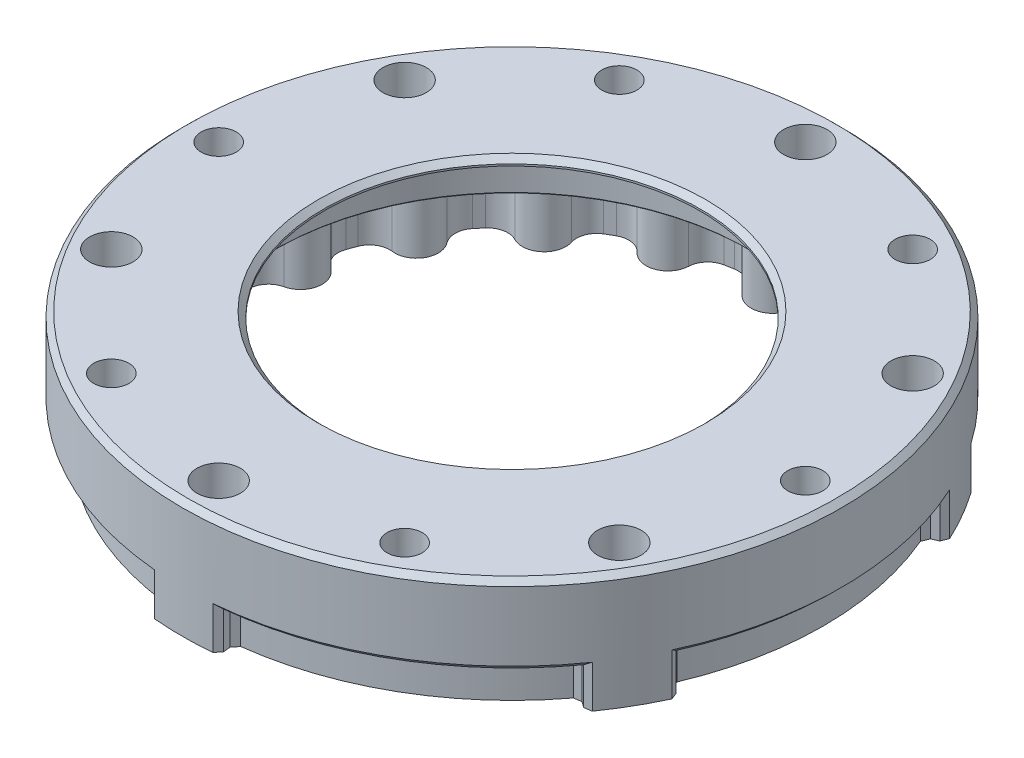
from build123d import *

# Parameters (mm, degrees)
SKETCH2_R                       = 45.5
SKETCH2_R_2                     = 37
BOSS_EXTRUDE1_DEPTH             = 7.125
BOSS_EXTRUDE2_REACH             = 66.74
BOSS_EXTRUDE2_DIRECTION_2_REACH = 66.74
FILLET1_R                       = 2.8
CIRPATTERN1_COUNT               = 18
FILLET1_OF_CIRPATTERN1_R        = 2.8
CUT_EXTRUDE1_REACH              = 67.906
SKETCH4_R                       = 1.59
BOSS_EXTRUDE3_START             = 9
SKETCH5_R                       = 45.5
SKETCH5_R_2                     = 1.59
SKETCH5_R_3                     = 32.56
BOSS_EXTRUDE3_DEPTH             = 9
SKETCH6_R                       = 32.56
SKETCH6_R_2                     = 30.56
BOSS_EXTRUDE4_DEPTH             = 1.5
SKETCH7_R                       = 3
SKETCH7_R_2                     = 1.59
SKETCH7_R_3                     = 2.425
CUT_EXTRUDE2_DEPTH              = 6
SKETCH9_R                       = 3
SKETCH9_R_2                     = 1.59
CUT_EXTRUDE3_DEPTH              = 0.7
SKETCH8_R                       = 30.56
SKETCH8_R_2                     = 26
BOSS_EXTRUDE5_DEPTH             = 1
CHAMFER1_SIZE                   = 0.75
CHAMFER2_SIZE                   = 0.2
CUT_EXTRUDE4_START              = -5.125
CUT_EXTRUDE4_DEPTH              = 5.125
CHAMFER3_DEPTH                  = 5.125
CHAMFER3_START                  = 5.125
CHAMFER3_2_DEPTH                = 0.731753644
CHAMFER3_START_2                = -1
CHAMFER3_3_DEPTH                = 6.125
CIRPATTERN3_COUNT               = 6


with BuildPart() as part:
    # Sketch2 → Boss-Extrude1 (new, symmetric)
    with BuildSketch(Plane(origin=(0, 0, 0), x_dir=(1, 0, 0), z_dir=(0, 1, 0))):
        with Locations(Location((0, 0, 0), (0, 0, 90))):
            Circle(SKETCH2_R)
        with Locations(Location((0, 0, 0), (0, 0, 90))):
            Circle(SKETCH2_R_2, mode=Mode.SUBTRACT)
    extrude(amount=BOSS_EXTRUDE1_DEPTH, both=True)

    # Boss-Extrude2: up to this face of the body (flat: up to its plane)
    boss_extrude2_end = Plane(part.part.faces().sort_by_distance((0, 7.125, 44.213065658))[0])
    # Sketch3 → Boss-Extrude2 (add, up to the picked face)
    with BuildSketch(Plane(origin=(0, 0, 0), x_dir=(1, 0, 0), z_dir=(0, 1, 0)), mode=Mode.PRIVATE) as boss_extrude2_sk1:
        with BuildLine():
            Line((-3, 36.01), (-3, 36.878177829))
            ThreePointArc((-3, 36.878177829), (0, 37), (3, 36.878177829))
            Line((3, 36.878177829), (3, 36.01))
            ThreePointArc((3, 36.01), (0, 33.01), (-3, 36.01))
        make_face()
    boss_extrude2_tool1 = split(extrude(boss_extrude2_sk1.sketch, amount=BOSS_EXTRUDE2_REACH, mode=Mode.PRIVATE), bisect_by=boss_extrude2_end, keep=Keep.BOTH, mode=Mode.PRIVATE)
    boss_extrude2 = boss_extrude2_tool1.solids().sort_by(Axis((0, 0, -35.238996), (0, 1, 0)))[0]
    add(boss_extrude2)

    # Boss-Extrude2 direction 2: up to this face of the body (flat: up to its plane)
    boss_extrude2_direction_2_end = Plane(part.part.faces().sort_by_distance((0, -7.125, 44.213065658))[0])
    # Sketch3 → Boss-Extrude2 direction 2 (add, up to the picked face)
    with BuildSketch(Plane(origin=(0, 0, 0), x_dir=(1, 0, 0), z_dir=(0, 1, 0)), mode=Mode.PRIVATE) as boss_extrude2_direction_2_sk1:
        with BuildLine():
            Line((-3, 36.01), (-3, 36.878177829))
            ThreePointArc((-3, 36.878177829), (0, 37), (3, 36.878177829))
            Line((3, 36.878177829), (3, 36.01))
            ThreePointArc((3, 36.01), (0, 33.01), (-3, 36.01))
        make_face()
    boss_extrude2_direction_2_tool1 = split(extrude(boss_extrude2_direction_2_sk1.sketch, amount=-BOSS_EXTRUDE2_DIRECTION_2_REACH, mode=Mode.PRIVATE), bisect_by=boss_extrude2_direction_2_end, keep=Keep.BOTH, mode=Mode.PRIVATE)
    boss_extrude2_direction_2 = boss_extrude2_direction_2_tool1.solids().sort_by(Axis((0, 0, -35.238996), (0, -1, 0)))[0]
    add(boss_extrude2_direction_2)

    # Fillet1
    fillet1_edges = [part.edges().sort_by_distance(p)[0] for p in [
        (-3, 0, -36.878177829),
        (3, 0, -36.878177829),
    ]]
    fillet(fillet1_edges, radius=FILLET1_R)

    # CirPattern1: Boss-Extrude2, Boss-Extrude2 direction 2 ×18 about axis
    cirpattern1_axis = Axis((0, 0, 0), (0, 1, 0))
    add([boss_extrude2.rotate(cirpattern1_axis, i * 360 / CIRPATTERN1_COUNT) for i in range(1, CIRPATTERN1_COUNT)])
    add([boss_extrude2_direction_2.rotate(cirpattern1_axis, i * 360 / CIRPATTERN1_COUNT) for i in range(1, CIRPATTERN1_COUNT)])

    # Fillet1 of CirPattern1
    fillet1_of_cirpattern1_edges = [part.edges().sort_by_distance(p)[0] for p in [
        (-15.432157529, 0, -33.628091144),
        (-9.794001804, 0, -35.680212004),
        (-26.002969106, 0, -26.321960369),
        (-21.406702447, 0, -30.178686027),
        (-33.437438845, 0, -15.841012703),
        (-30.437438845, 0, -21.037165126),
        (-36.838859976, 0, -3.449405117),
        (-35.79697091, 0, -9.358251635),
        (-35.79697091, 0, 9.358251635),
        (-36.838859976, 0, 3.449405117),
        (-30.437438845, 0, 21.037165126),
        (-33.437438845, 0, 15.841012703),
        (-21.406702447, 0, 30.178686027),
        (-26.002969106, 0, 26.321960369),
        (-9.794001804, 0, 35.680212004),
        (-15.432157529, 0, 33.628091144),
        (3, 0, 36.878177829),
        (-3, 0, 36.878177829),
        (15.432157529, 0, 33.628091144),
        (9.794001804, 0, 35.680212004),
        (26.002969106, 0, 26.321960369),
        (21.406702447, 0, 30.178686027),
        (33.437438845, 0, 15.841012703),
        (30.437438845, 0, 21.037165126),
        (36.838859976, 0, 3.449405117),
        (35.79697091, 0, 9.358251635),
        (35.79697091, 0, -9.358251635),
        (36.838859976, 0, -3.449405117),
        (30.437438845, 0, -21.037165126),
        (33.437438845, 0, -15.841012703),
        (21.406702447, 0, -30.178686027),
        (26.002969106, 0, -26.321960369),
        (9.794001804, 0, -35.680212004),
        (15.432157529, 0, -33.628091144),
    ]]
    fillet(fillet1_of_cirpattern1_edges, radius=FILLET1_OF_CIRPATTERN1_R)

    # Sketch4 → Cut-Extrude1 (cut, up to next)
    with BuildSketch(Plane(origin=(0, 7.125, 0), x_dir=(1, 0, 0), z_dir=(0, 1, 0)), mode=Mode.PRIVATE) as cut_extrude1_sk1:
        with Locations(Location((0, 40.5, 0), (0, 0, 270))):
            Circle(SKETCH4_R)
    cut_extrude1_tool1 = extrude(cut_extrude1_sk1.sketch, amount=-CUT_EXTRUDE1_REACH, mode=Mode.PRIVATE) & part.part
    # Sketch4 → Cut-Extrude1 (cut, up to next)
    with BuildSketch(Plane(origin=(0, 7.125, 0), x_dir=(1, 0, 0), z_dir=(0, 1, 0)), mode=Mode.PRIVATE) as cut_extrude1_sk2:
        with Locations(Location((35.074028853, 20.25, 0), (0, 0, 270))):
            Circle(SKETCH4_R)
    cut_extrude1_tool2 = extrude(cut_extrude1_sk2.sketch, amount=-CUT_EXTRUDE1_REACH, mode=Mode.PRIVATE) & part.part
    # Sketch4 → Cut-Extrude1 (cut, up to next)
    with BuildSketch(Plane(origin=(0, 7.125, 0), x_dir=(1, 0, 0), z_dir=(0, 1, 0)), mode=Mode.PRIVATE) as cut_extrude1_sk3:
        with Locations(Location((35.074028853, -20.25, 0), (0, 0, 270))):
            Circle(SKETCH4_R)
    cut_extrude1_tool3 = extrude(cut_extrude1_sk3.sketch, amount=-CUT_EXTRUDE1_REACH, mode=Mode.PRIVATE) & part.part
    # Sketch4 → Cut-Extrude1 (cut, up to next)
    with BuildSketch(Plane(origin=(0, 7.125, 0), x_dir=(1, 0, 0), z_dir=(0, 1, 0)), mode=Mode.PRIVATE) as cut_extrude1_sk4:
        with Locations(Location((0, -40.5, 0), (0, 0, 270))):
            Circle(SKETCH4_R)
    cut_extrude1_tool4 = extrude(cut_extrude1_sk4.sketch, amount=-CUT_EXTRUDE1_REACH, mode=Mode.PRIVATE) & part.part
    # Sketch4 → Cut-Extrude1 (cut, up to next)
    with BuildSketch(Plane(origin=(0, 7.125, 0), x_dir=(1, 0, 0), z_dir=(0, 1, 0)), mode=Mode.PRIVATE) as cut_extrude1_sk5:
        with Locations(Location((-35.074028853, -20.25, 0), (0, 0, 270))):
            Circle(SKETCH4_R)
    cut_extrude1_tool5 = extrude(cut_extrude1_sk5.sketch, amount=-CUT_EXTRUDE1_REACH, mode=Mode.PRIVATE) & part.part
    # Sketch4 → Cut-Extrude1 (cut, up to next)
    with BuildSketch(Plane(origin=(0, 7.125, 0), x_dir=(1, 0, 0), z_dir=(0, 1, 0)), mode=Mode.PRIVATE) as cut_extrude1_sk6:
        with Locations(Location((-35.074028853, 20.25, 0), (0, 0, 270))):
            Circle(SKETCH4_R)
    cut_extrude1_tool6 = extrude(cut_extrude1_sk6.sketch, amount=-CUT_EXTRUDE1_REACH, mode=Mode.PRIVATE) & part.part
    add(cut_extrude1_tool1.solids().sort_by_distance((0, 7.125, -40.5))[0], mode=Mode.SUBTRACT)
    add(cut_extrude1_tool2.solids().sort_by_distance((35.074029, 7.125, -20.25))[0], mode=Mode.SUBTRACT)
    add(cut_extrude1_tool3.solids().sort_by_distance((35.074029, 7.125, 20.25))[0], mode=Mode.SUBTRACT)
    add(cut_extrude1_tool4.solids().sort_by_distance((0, 7.125, 40.5))[0], mode=Mode.SUBTRACT)
    add(cut_extrude1_tool5.solids().sort_by_distance((-35.074029, 7.125, 20.25))[0], mode=Mode.SUBTRACT)
    add(cut_extrude1_tool6.solids().sort_by_distance((-35.074029, 7.125, -20.25))[0], mode=Mode.SUBTRACT)

    # Sketch5 → Boss-Extrude3 (add)
    with BuildSketch(Plane(origin=(0, 7.125, 0), x_dir=(1, 0, 0), z_dir=(0, 1, 0)).offset(BOSS_EXTRUDE3_START)):
        with Locations(Location((0, 0, 0), (0, 0, 90))):
            Circle(SKETCH5_R)
        with Locations(Location((0, 40.5, 0), (0, 0, 270))):
            Circle(SKETCH5_R_2, mode=Mode.SUBTRACT)
        with Locations(Location((35.074028853, 20.25, 0), (0, 0, 270))):
            Circle(SKETCH5_R_2, mode=Mode.SUBTRACT)
        with Locations(Location((35.074028853, -20.25, 0), (0, 0, 270))):
            Circle(SKETCH5_R_2, mode=Mode.SUBTRACT)
        with Locations(Location((0, -40.5, 0), (0, 0, 270))):
            Circle(SKETCH5_R_2, mode=Mode.SUBTRACT)
        with Locations(Location((-35.074028853, -20.25, 0), (0, 0, 270))):
            Circle(SKETCH5_R_2, mode=Mode.SUBTRACT)
        with Locations(Location((-35.074028853, 20.25, 0), (0, 0, 270))):
            Circle(SKETCH5_R_2, mode=Mode.SUBTRACT)
        with Locations(Location((0, 0, 0), (0, 0, 270))):
            Circle(SKETCH5_R_3, mode=Mode.SUBTRACT)
    extrude(amount=-BOSS_EXTRUDE3_DEPTH)

    # Sketch6 → Boss-Extrude4 (add)
    with BuildSketch(Plane(origin=(0, 16.125, 0), x_dir=(1, 0, 0), z_dir=(0, 1, 0))):
        with Locations(Location((0, 0, 0), (0, 0, 270))):
            Circle(SKETCH6_R)
        with Locations(Location((0, 0, 0), (0, 0, 270))):
            Circle(SKETCH6_R_2, mode=Mode.SUBTRACT)
    extrude(amount=-BOSS_EXTRUDE4_DEPTH)

    # Sketch7 → Cut-Extrude2 (cut)
    # profile 1 of 12: a face of its own
    with BuildSketch(Plane(origin=(0, 16.125, 0), x_dir=(1, 0, 0), z_dir=(0, 1, 0))):
        with Locations(Location((35.074028853, -20.25, 0), (0, 0, 270))):
            Circle(SKETCH7_R)
        with Locations(Location((35.074028853, -20.25, 0), (0, 0, 270))):
            Circle(SKETCH7_R_2, mode=Mode.SUBTRACT)
    # profile 2 of 12: a face of its own
    with BuildSketch(Plane(origin=(0, 16.125, 0), x_dir=(1, 0, 0), z_dir=(0, 1, 0))):
        with Locations(Location((20.25, -35.074028853, 0), (0, 0, 270))):
            Circle(SKETCH7_R_3)
    # profile 3 of 12: a face of its own
    with BuildSketch(Plane(origin=(0, 16.125, 0), x_dir=(1, 0, 0), z_dir=(0, 1, 0))):
        with Locations(Location((-20.25, -35.074028853, 0), (0, 0, 270))):
            Circle(SKETCH7_R_3)
    # profile 4 of 12: a face of its own
    with BuildSketch(Plane(origin=(0, 16.125, 0), x_dir=(1, 0, 0), z_dir=(0, 1, 0))):
        with Locations(Location((-35.074028853, -20.25, 0), (0, 0, 270))):
            Circle(SKETCH7_R)
        with Locations(Location((-35.074028853, -20.25, 0), (0, 0, 270))):
            Circle(SKETCH7_R_2, mode=Mode.SUBTRACT)
    # profile 5 of 12: a face of its own
    with BuildSketch(Plane(origin=(0, 16.125, 0), x_dir=(1, 0, 0), z_dir=(0, 1, 0))):
        with Locations(Location((-40.5, 0, 0), (0, 0, 270))):
            Circle(SKETCH7_R_3)
    # profile 6 of 12: a face of its own
    with BuildSketch(Plane(origin=(0, 16.125, 0), x_dir=(1, 0, 0), z_dir=(0, 1, 0))):
        with Locations(Location((-35.074028853, 20.25, 0), (0, 0, 270))):
            Circle(SKETCH7_R)
        with Locations(Location((-35.074028853, 20.25, 0), (0, 0, 270))):
            Circle(SKETCH7_R_2, mode=Mode.SUBTRACT)
    # profile 7 of 12: a face of its own
    with BuildSketch(Plane(origin=(0, 16.125, 0), x_dir=(1, 0, 0), z_dir=(0, 1, 0))):
        with Locations(Location((-20.25, 35.074028853, 0), (0, 0, 270))):
            Circle(SKETCH7_R_3)
    # profile 8 of 12: a face of its own
    with BuildSketch(Plane(origin=(0, 16.125, 0), x_dir=(1, 0, 0), z_dir=(0, 1, 0))):
        with Locations(Location((0, 40.5, 0), (0, 0, 270))):
            Circle(SKETCH7_R)
        with Locations(Location((0, 40.5, 0), (0, 0, 270))):
            Circle(SKETCH7_R_2, mode=Mode.SUBTRACT)
    # profile 9 of 12: a face of its own
    with BuildSketch(Plane(origin=(0, 16.125, 0), x_dir=(1, 0, 0), z_dir=(0, 1, 0))):
        with Locations(Location((20.25, 35.074028853, 0), (0, 0, 270))):
            Circle(SKETCH7_R_3)
    # profile 10 of 12: a face of its own
    with BuildSketch(Plane(origin=(0, 16.125, 0), x_dir=(1, 0, 0), z_dir=(0, 1, 0))):
        with Locations(Location((35.074028853, 20.25, 0), (0, 0, 270))):
            Circle(SKETCH7_R)
    # profile 11 of 12: a face of its own
    with BuildSketch(Plane(origin=(0, 16.125, 0), x_dir=(1, 0, 0), z_dir=(0, 1, 0))):
        with Locations(Location((40.5, 0, 0), (0, 0, 270))):
            Circle(SKETCH7_R_3)
    # profile 12 of 12: a face of its own
    with BuildSketch(Plane(origin=(0, 16.125, 0), x_dir=(1, 0, 0), z_dir=(0, 1, 0))):
        with Locations(Location((0, -40.5, 0), (0, 0, 270))):
            Circle(SKETCH7_R)
    extrude(amount=-CUT_EXTRUDE2_DEPTH, mode=Mode.SUBTRACT)

    # Sketch9 → Cut-Extrude3 (cut)
    # profile 1 of 6: a face of its own
    with BuildSketch(Plane(origin=(0, 10.125, 0), x_dir=(1, 0, 0), z_dir=(0, 1, 0))):
        with Locations(Location((-35.074028853, -20.25, 0), (0, 0, 270))):
            Circle(SKETCH9_R)
        with Locations(Location((-35.074028853, -20.25, 0), (0, 0, 270))):
            Circle(SKETCH9_R_2, mode=Mode.SUBTRACT)
    # profile 2 of 6: a face of its own
    with BuildSketch(Plane(origin=(0, 10.125, 0), x_dir=(1, 0, 0), z_dir=(0, 1, 0))):
        with Locations(Location((0, -40.5, 0), (0, 0, 270))):
            Circle(SKETCH9_R)
        with Locations(Location((0, -40.5, 0), (0, 0, 270))):
            Circle(SKETCH9_R_2, mode=Mode.SUBTRACT)
    # profile 3 of 6: a face of its own
    with BuildSketch(Plane(origin=(0, 10.125, 0), x_dir=(1, 0, 0), z_dir=(0, 1, 0))):
        with Locations(Location((35.074028853, -20.25, 0), (0, 0, 270))):
            Circle(SKETCH9_R)
        with Locations(Location((35.074028853, -20.25, 0), (0, 0, 270))):
            Circle(SKETCH9_R_2, mode=Mode.SUBTRACT)
    # profile 4 of 6: a face of its own
    with BuildSketch(Plane(origin=(0, 10.125, 0), x_dir=(1, 0, 0), z_dir=(0, 1, 0))):
        with Locations(Location((35.074028853, 20.25, 0), (0, 0, 270))):
            Circle(SKETCH9_R)
        with Locations(Location((35.074028853, 20.25, 0), (0, 0, 270))):
            Circle(SKETCH9_R_2, mode=Mode.SUBTRACT)
    # profile 5 of 6: a face of its own
    with BuildSketch(Plane(origin=(0, 10.125, 0), x_dir=(1, 0, 0), z_dir=(0, 1, 0))):
        with Locations(Location((0, 40.5, 0), (0, 0, 270))):
            Circle(SKETCH9_R)
        with Locations(Location((0, 40.5, 0), (0, 0, 270))):
            Circle(SKETCH9_R_2, mode=Mode.SUBTRACT)
    # profile 6 of 6: a face of its own
    with BuildSketch(Plane(origin=(0, 10.125, 0), x_dir=(1, 0, 0), z_dir=(0, 1, 0))):
        with Locations(Location((-35.074028853, 20.25, 0), (0, 0, 270))):
            Circle(SKETCH9_R)
        with Locations(Location((-35.074028853, 20.25, 0), (0, 0, 270))):
            Circle(SKETCH9_R_2, mode=Mode.SUBTRACT)
    extrude(amount=-CUT_EXTRUDE3_DEPTH, mode=Mode.SUBTRACT)

    # Sketch8 → Boss-Extrude5 (add)
    with BuildSketch(Plane(origin=(0, 16.125, 0), x_dir=(1, 0, 0), z_dir=(0, 1, 0))):
        with Locations(Location((0, 0, 0), (0, 0, 270))):
            Circle(SKETCH8_R)
        with Locations(Location((0, 0, 0), (0, 0, 270))):
            Circle(SKETCH8_R_2, mode=Mode.SUBTRACT)
    extrude(amount=-BOSS_EXTRUDE5_DEPTH)

    # Chamfer1
    chamfer1_edges = [part.edges().sort_by_distance(p)[0] for p in [
        (0, 16.125, 45.5),
        (0, 16.125, -26),
    ]]
    chamfer(chamfer1_edges, length=CHAMFER1_SIZE)

    # SurfaceCut1
    split(bisect_by=Plane(origin=(0, 0, 0), x_dir=(1, 0, 0), z_dir=(0, 1, 0)), keep=Keep.TOP)

    # Chamfer2
    chamfer2_edges = [part.edges().sort_by_distance(p)[0] for p in [
        (0, 7.125, -32.56),
    ]]
    chamfer(chamfer2_edges, length=CHAMFER2_SIZE)

    # Sketch10 → Cut-Extrude4 (cut)
    with BuildSketch(Plane.XZ.offset(CUT_EXTRUDE4_START)):
        with BuildLine():
            Line((-39.282454679, 17.489675652), (-41.566318323, 18.50651726))
            ThreePointArc((-41.566318323, 18.50651726), (-45.5, 0), (-41.566318323, -18.50651726))
            Line((-41.566318323, -18.50651726), (-39.282454679, -17.489675652))
            ThreePointArc((-39.282454679, -17.489675652), (-43, 0), (-39.282454679, 17.489675652))
        make_face()
    cut_extrude4 = extrude(amount=CUT_EXTRUDE4_DEPTH, mode=Mode.SUBTRACT)

    # Chamfer3: read off the stored shape, not the designer's step
    # Chamfer3 outline → Chamfer3 (add)
    with BuildSketch(Plane(origin=(0, 0, 0), x_dir=(1, 0, 0), z_dir=(0, 1, 0))):
        with BuildLine():
            Line((-39.961740548, 17.792113207), (-39.57650515, 16.813692043))
            ThreePointArc((-39.57650515, 16.813692043), (-39.430928531, 17.15231399), (-39.282454679, 17.489675652))
            Line((-39.282454679, 17.489675652), (-39.961740548, 17.792113207))
        make_face()
        with BuildLine():
            Line((-39.57650515, -16.813692043), (-39.961740548, -17.792113207))
            Line((-39.961740548, -17.792113207), (-39.282454679, -17.489675652))
            ThreePointArc((-39.282454679, -17.489675652), (-39.430928531, -17.15231399), (-39.57650515, -16.813692043))
        make_face()
    chamfer3 = extrude(amount=CHAMFER3_DEPTH)

    # Chamfer3 2 outline → Chamfer3 2 (cut)
    with BuildSketch(Plane(origin=(0, 0, 0), x_dir=(1, 0, 0), z_dir=(0, 1, 0)).offset(CHAMFER3_START)):
        with BuildLine():
            Line((-41.25818349, -19.183646555), (-40.88115923, -18.201464778))
            Line((-40.88115923, -18.201464778), (-39.961740548, -17.792113207))
            Line((-39.961740548, -17.792113207), (-39.57650515, -16.813692043))
            ThreePointArc((-39.57650515, -16.813692043), (-43, 0), (-39.57650515, 16.813692043))
            Line((-39.57650515, 16.813692043), (-39.961740548, 17.792113207))
            Line((-39.961740548, 17.792113207), (-40.88115923, 18.201464778))
            Line((-40.88115923, 18.201464778), (-41.25818349, 19.183646555))
            ThreePointArc((-41.25818349, 19.183646555), (-45.5, 0), (-41.25818349, -19.183646555))
        make_face()
    chamfer3_2 = extrude(amount=CHAMFER3_2_DEPTH, mode=Mode.SUBTRACT)

    # Chamfer3 3 outline → Chamfer3 3 (cut)
    with BuildSketch(Plane(origin=(0, 0, 0), x_dir=(1, 0, 0), z_dir=(0, 1, 0)).offset(CHAMFER3_START_2)):
        with BuildLine():
            ThreePointArc((-41.566318323, -18.50651726), (-41.413634846, -18.845711684), (-41.25818349, -19.183646555))
            Line((-41.25818349, -19.183646555), (-40.88115923, -18.201464778))
            Line((-40.88115923, -18.201464778), (-41.566318323, -18.50651726))
        make_face()
        with BuildLine():
            ThreePointArc((-41.25818349, 19.183646555), (-41.413634846, 18.845711684), (-41.566318323, 18.50651726))
            Line((-41.566318323, 18.50651726), (-40.88115923, 18.201464778))
            Line((-40.88115923, 18.201464778), (-41.25818349, 19.183646555))
        make_face()
    chamfer3_3 = extrude(amount=CHAMFER3_3_DEPTH, mode=Mode.SUBTRACT)

    # Chamfer3 4 outline → Chamfer3 4 (revolve)
    with BuildSketch(Plane.XY):
        Polygon((43, 5.856753644), (43, 4.375), (43.75, 5.125), (44.75598243, 5.125), (45.5, 5.856753544), align=None)
    chamfer3_4 = revolve(axis=Axis((0, 0, 0), (0, 1, 0)))

    # CirPattern3: Cut-Extrude4, Chamfer3, Chamfer3 2, Chamfer3 3, Chamfer3 4 ×6 about axis
    cirpattern3_axis = Axis((0, 0, 0), (0, 1, 0))
    add([cut_extrude4.rotate(cirpattern3_axis, i * 360 / CIRPATTERN3_COUNT) for i in range(1, CIRPATTERN3_COUNT)], mode=Mode.SUBTRACT)
    add([chamfer3.rotate(cirpattern3_axis, i * 360 / CIRPATTERN3_COUNT) for i in range(1, CIRPATTERN3_COUNT)])
    add([chamfer3_2.rotate(cirpattern3_axis, i * 360 / CIRPATTERN3_COUNT) for i in range(1, CIRPATTERN3_COUNT)], mode=Mode.SUBTRACT)
    add([chamfer3_3.rotate(cirpattern3_axis, i * 360 / CIRPATTERN3_COUNT) for i in range(1, CIRPATTERN3_COUNT)], mode=Mode.SUBTRACT)
    add([chamfer3_4.rotate(cirpattern3_axis, i * 360 / CIRPATTERN3_COUNT) for i in range(1, CIRPATTERN3_COUNT)])


solid = part.part
